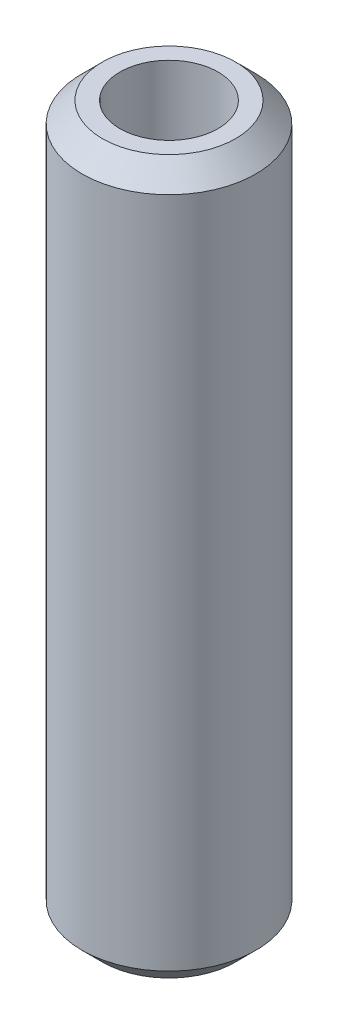
from build123d import *

# Parameters (mm, degrees)
SKETCH1_R           = 25
BOSS_EXTRUDE1_DEPTH = 205.179860331
SKETCH2_R           = 14.129188118
CUT_EXTRUDE1_DEPTH  = 209.203686531
CHAMFER1_SIZE       = 5.855293409


with BuildPart() as part:
    # Sketch1 → Boss-Extrude1 (new body)
    with BuildSketch(Plane(origin=(0, 0, 0), x_dir=(1, 0, 0), z_dir=(0, 1, 0))):
        Circle(SKETCH1_R)
    extrude(amount=BOSS_EXTRUDE1_DEPTH)

    # Sketch2 → Cut-Extrude1 (cut, through all)
    with BuildSketch(Plane(origin=(0, 0, 0), x_dir=(1, 0, 0), z_dir=(0, 1, 0))):
        Circle(SKETCH2_R)
    extrude(amount=CUT_EXTRUDE1_DEPTH, mode=Mode.SUBTRACT)

    # Chamfer1
    chamfer1_edges = [part.edges().sort_by_distance(p)[0] for p in [
        (-25, 205.179860331, 0),
        (-25, 0, 0),
    ]]
    chamfer(chamfer1_edges, length=CHAMFER1_SIZE)


solid = part.part
